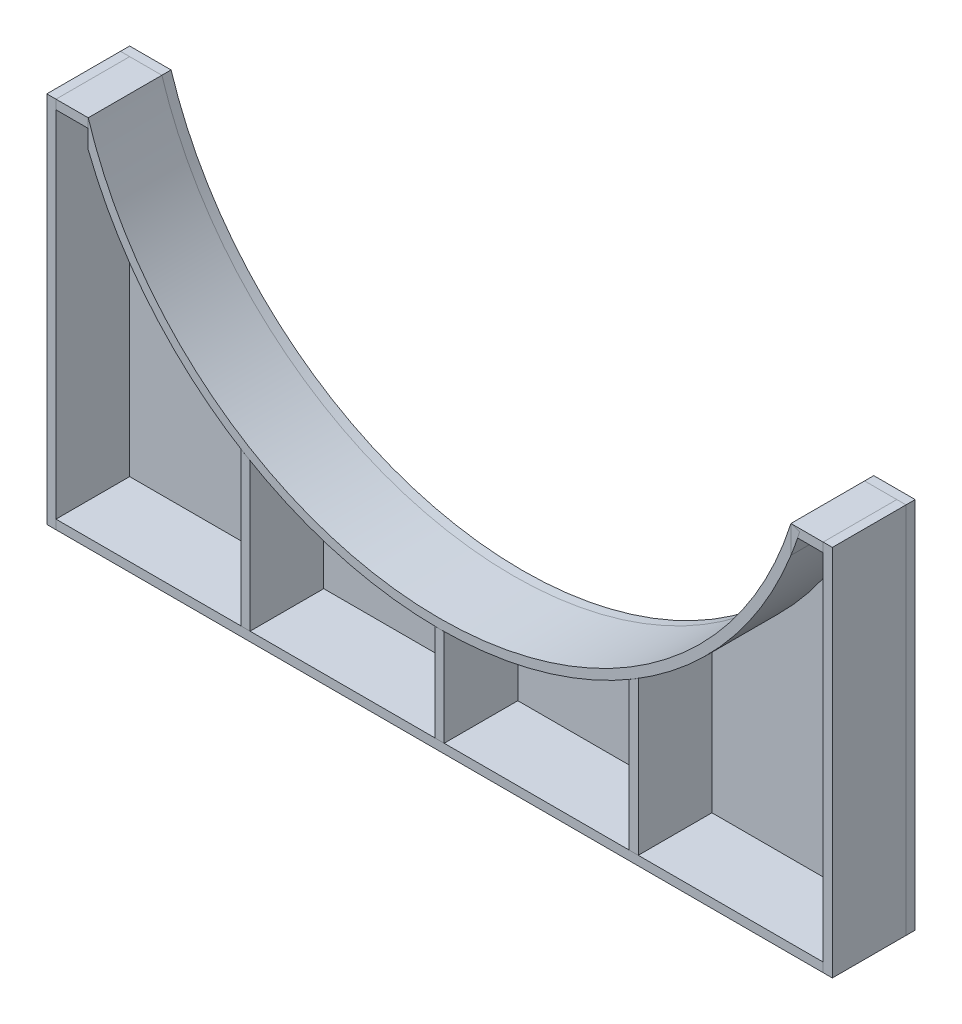
from build123d import *

# Parameters (mm, degrees)
FLAT_START                                = -50.8001016
FLAT_BAR_CONFIGURED_FB_4_X_0_5_1_OUT_W    = 12.7000254
FLAT_BAR_CONFIGURED_FB_4_X_0_5_1_OUT_H    = 514.351028702
FLAT_BAR_CONFIGURED_FB_4_X_0_5_1_DEPTH    = 101.6002032
FLAT_BAR_CONFIGURED_FB_4_X_0_5_1_2_O_W    = 1058.104141648
FLAT_BAR_CONFIGURED_FB_4_X_0_5_1_2_O_H    = 12.7000254
FLAT_BAR_CONFIGURED_FB_4_X_0_5_1_2_DEPTH  = 101.6002032
FLAT_BAR_CONFIGURED_FB_4_X_0_5_1_3_O_W    = 12.7000254
FLAT_BAR_CONFIGURED_FB_4_X_0_5_1_3_O_H    = 514.351028702
FLAT_BAR_CONFIGURED_FB_4_X_0_5_1_3_DEPTH  = 101.6002032
LAYOUT11_W                                = 101.6
LAYOUT11_H                                = 12.7
MIDDLE_BAR_DEPTH                          = 152.400304801
LAYOUT6_W                                 = 101.6
LAYOUT6_H                                 = 12.7
FLAT_BAR_CONFIGURED_FB_4_X_0_5_4_DEPTH    = 50.8
LAYOUT7_W                                 = 101.6
LAYOUT7_H                                 = 12.7
FLAT_BAR_CONFIGURED_FB_4_X_0_5_5_DEPTH    = 50.8
FLAT_START_2                              = -50.8
FLAT_BAR_CONFIGURED_FB_4_X_0_5_6_DEPTH    = 101.6
TRIM_EXTEND12_START                       = -50.8
TRIM_EXTEND12_DEPTH                       = 101.6
LAYOUT9_W                                 = 101.6
LAYOUT9_H                                 = 12.7
FLAT_BAR_CONFIGURED_FB_4_X_0_5_15_DEPTH   = 228.659286135
LAYOUT9_ON_SEGMENT_2_W                    = 101.6
LAYOUT9_ON_SEGMENT_2_H                    = 12.7
FLAT_BAR_CONFIGURED_FB_4_X_0_5_15_2_DEPTH = 228.659286135
BOSS_EXTRUDE1_DEPTH                       = 12.7


# Read off the part's stored shape, not the designer's step: Flat bar - configured FB - 4 X 0.5(1), Flat bar - configured FB - 4 X 0.5(6), Trim/Extend11, Trim/Extend12
with BuildPart() as part:
    # Flat bar - configured FB - 4 X 0.5(1) out → Flat bar - configured FB - 4 X 0.5(1) (new body)
    with BuildSketch(Plane.XY.offset(FLAT_START)):
        with Locations((-535.402083524, -3.17500635)):
            Rectangle(FLAT_BAR_CONFIGURED_FB_4_X_0_5_1_OUT_W, FLAT_BAR_CONFIGURED_FB_4_X_0_5_1_OUT_H)
    extrude(amount=FLAT_BAR_CONFIGURED_FB_4_X_0_5_1_DEPTH)


with BuildPart() as body_2:
    # Flat bar - configured FB - 4 X 0.5_1 2 o → Flat bar - configured FB - 4 X 0.5_1 2 (new body)
    with BuildSketch(Plane.XY.offset(FLAT_START)):
        with Locations((0, -254.000508001)):
            Rectangle(FLAT_BAR_CONFIGURED_FB_4_X_0_5_1_2_O_W, FLAT_BAR_CONFIGURED_FB_4_X_0_5_1_2_O_H)
    extrude(amount=FLAT_BAR_CONFIGURED_FB_4_X_0_5_1_2_DEPTH)


with BuildPart() as body_3:
    # Flat bar - configured FB - 4 X 0.5_1 3 o → Flat bar - configured FB - 4 X 0.5_1 3 (new body)
    with BuildSketch(Plane.XY.offset(FLAT_START)):
        with Locations((535.402083524, -3.17500635)):
            Rectangle(FLAT_BAR_CONFIGURED_FB_4_X_0_5_1_3_O_W, FLAT_BAR_CONFIGURED_FB_4_X_0_5_1_3_O_H)
    extrude(amount=FLAT_BAR_CONFIGURED_FB_4_X_0_5_1_3_DEPTH)


with BuildPart() as body_4:
    # Layout11 → Middle Bar (new body)
    with BuildSketch(Plane(origin=(0, -101.6002032, 0), x_dir=(0, 0, 1), z_dir=(0, -1, 0))):
        Rectangle(LAYOUT11_W, LAYOUT11_H)
    extrude(amount=MIDDLE_BAR_DEPTH)

    # Trim/Extend1
    split(bisect_by=Plane(origin=(0, -247.650495301, 0), x_dir=(-1, 0, 0), z_dir=(0, 1, 0)), keep=Keep.TOP)

    # Trim/Extend12 outline → Trim/Extend12 (cut)
    with BuildSketch(Plane.XY.offset(TRIM_EXTEND12_START)):
        with BuildLine():
            ThreePointArc((-6.35, -114.261482324), (0, -114.3002032), (6.35, -114.261482324))
            Line((6.35, -114.261482324), (6.35, -101.6002032))
            Line((6.35, -101.6002032), (-6.35, -101.6002032))
            Line((-6.35, -101.6002032), (-6.35, -114.261482324))
        make_face()
    extrude(amount=TRIM_EXTEND12_DEPTH, mode=Mode.SUBTRACT)


with BuildPart() as body_5:
    # Layout6 → Flat bar - configured FB - 4 X 0.5(4) (new body)
    with BuildSketch(Plane(origin=(-535.402083524, 247.650508001, 0), x_dir=(0, 0, 1), z_dir=(1, 0, 0))):
        Rectangle(LAYOUT6_W, LAYOUT6_H)
    extrude(amount=FLAT_BAR_CONFIGURED_FB_4_X_0_5_4_DEPTH)

    # Trim/Extend7
    split(bisect_by=Plane(origin=(-529.052070824, -3.17500635, 0), x_dir=(0, 1, 0), z_dir=(1, 0, 0)), keep=Keep.TOP)


with BuildPart() as body_6:
    # Layout7 → Flat bar - configured FB - 4 X 0.5(5) (new body)
    with BuildSketch(Plane(origin=(535.402083524, 247.650508001, 0), x_dir=(0, 0, 1), z_dir=(-1, 0, 0))):
        Rectangle(LAYOUT7_W, LAYOUT7_H)
    extrude(amount=FLAT_BAR_CONFIGURED_FB_4_X_0_5_5_DEPTH)

    # Trim/Extend8
    split(bisect_by=Plane(origin=(529.052070824, -3.17500635, 0), x_dir=(0, -1, 0), z_dir=(-1, 0, 0)), keep=Keep.TOP)


with BuildPart() as body_7:
    # Flat bar - configured FB - 4 X 0.5(6) out → Flat bar - configured FB - 4 X 0.5(6) (new body)
    with BuildSketch(Plane.XY.offset(FLAT_START_2)):
        with BuildLine():
            Line((496.717111382, 250.190508001), (484.602083524, 254.000508001))
            ThreePointArc((484.602083524, 254.000508001), (0, -101.6002032), (-484.602083524, 254.000508001))
            Line((-484.602083524, 254.000508001), (-496.717111382, 250.190508001))
            ThreePointArc((-496.717111382, 250.190508001), (0, -114.3002032), (496.717111382, 250.190508001))
        make_face()
    extrude(amount=FLAT_BAR_CONFIGURED_FB_4_X_0_5_6_DEPTH)

    # Trim/Extend9
    split(bisect_by=Plane(origin=(-484.602083524, 247.650508001, 0), x_dir=(0, 1, 0), z_dir=(1, 0, 0)), keep=Keep.TOP)


with BuildPart() as body_8:
    # Trim/Extend11: the piece on the far side of the plane
    add(body_7.part)
    split(bisect_by=Plane.YZ.offset(484.602083524), keep=Keep.BOTTOM)


with BuildPart() as body_7_1:
    add(body_7.part)

    # Trim/Extend11
    split(bisect_by=Plane.YZ.offset(484.602083524), keep=Keep.TOP)


with BuildPart() as body_9:
    # Layout9 → Flat bar - configured FB - 4 X 0.5(15) (new body)
    with BuildSketch(Plane(origin=(-267.701041762, -25.341221866, 0), x_dir=(0, 0, 1), z_dir=(0, -1, 0))):
        Rectangle(LAYOUT9_W, LAYOUT9_H)
    extrude(amount=FLAT_BAR_CONFIGURED_FB_4_X_0_5_15_DEPTH)

    # Trim_Extend13 4: cut back where it meets the other member's skin (coped)
    split(bisect_by=body_8.part.faces().sort_by_distance((0, -114.3002032, 0))[0], keep=Keep.TOP)


with BuildPart() as body_10:
    # Layout9 on segment 2 (carried to segment 2) → Flat bar - configured FB - 4 X 0.5_15 2 (new body)
    with BuildSketch(Plane(origin=(267.701041762, -25.341221866, 0), x_dir=(0, 0, 1), z_dir=(0, -1, 0))):
        Rectangle(LAYOUT9_ON_SEGMENT_2_W, LAYOUT9_ON_SEGMENT_2_H)
    extrude(amount=FLAT_BAR_CONFIGURED_FB_4_X_0_5_15_2_DEPTH)

    # Trim_Extend13 4: cut back where it meets the other member's skin (coped)
    split(bisect_by=body_8.part.faces().sort_by_distance((0, -114.3002032, 0))[0], keep=Keep.TOP)


with BuildPart() as body_11:
    # Sketch3 → Boss-Extrude1 (new body)
    with BuildSketch(Plane(origin=(0, 0, -50.8001016), x_dir=(-1, 0, 0), z_dir=(0, 0, -1))):
        with BuildLine():
            Line((541.752096224, -260.350520701), (541.752096224, 254.000508001))
            Line((541.752096224, 254.000508001), (484.602083524, 254.000508001))
            ThreePointArc((484.602083524, 254.000508001), (0, -101.6002032), (-484.602083524, 254.000508001))
            Line((-484.602083524, 254.000508001), (-541.752096224, 254.000508001))
            Line((-541.752096224, 254.000508001), (-541.752096224, -260.350520701))
            Line((-541.752096224, -260.350520701), (541.752096224, -260.350520701))
        make_face()
    extrude(amount=BOSS_EXTRUDE1_DEPTH)


solid = Compound([part.part, body_2.part, body_3.part, body_4.part, body_5.part, body_6.part, body_8.part, body_7_1.part, body_9.part, body_10.part, body_11.part])
